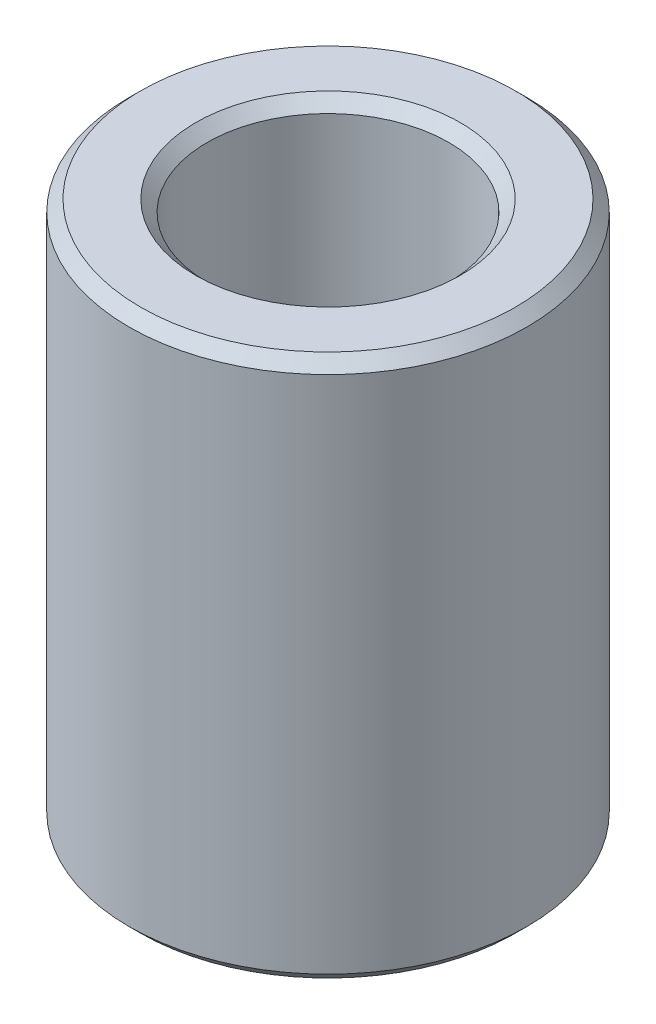
from build123d import *

# Parameters (mm, degrees)
SKETCH1_R           = 52.5
BOSS_EXTRUDE1_DEPTH = 143.126735819
SKETCH2_R           = 31.916309545
CUT_EXTRUDE1_DEPTH  = 162.238216643
CHAMFER1_SIZE       = 3.028377148


with BuildPart() as part:
    # Sketch1 → Boss-Extrude1 (new body)
    with BuildSketch(Plane(origin=(0, 0, 0), x_dir=(1, 0, 0), z_dir=(0, 1, 0))):
        Circle(SKETCH1_R)
    extrude(amount=BOSS_EXTRUDE1_DEPTH)

    # Sketch2 → Cut-Extrude1 (cut, through all)
    with BuildSketch(Plane(origin=(0, 0, 0), x_dir=(1, 0, 0), z_dir=(0, 1, 0))):
        Circle(SKETCH2_R)
    extrude(amount=CUT_EXTRUDE1_DEPTH, mode=Mode.SUBTRACT)

    # Chamfer1
    chamfer1_edges = [part.edges().sort_by_distance(p)[0] for p in [
        (-31.916309545, 143.126735819, 0),
        (-31.916309545, 0, 0),
        (-52.5, 0, 0),
        (-52.5, 143.126735819, 0),
    ]]
    chamfer(chamfer1_edges, length=CHAMFER1_SIZE)


solid = part.part
